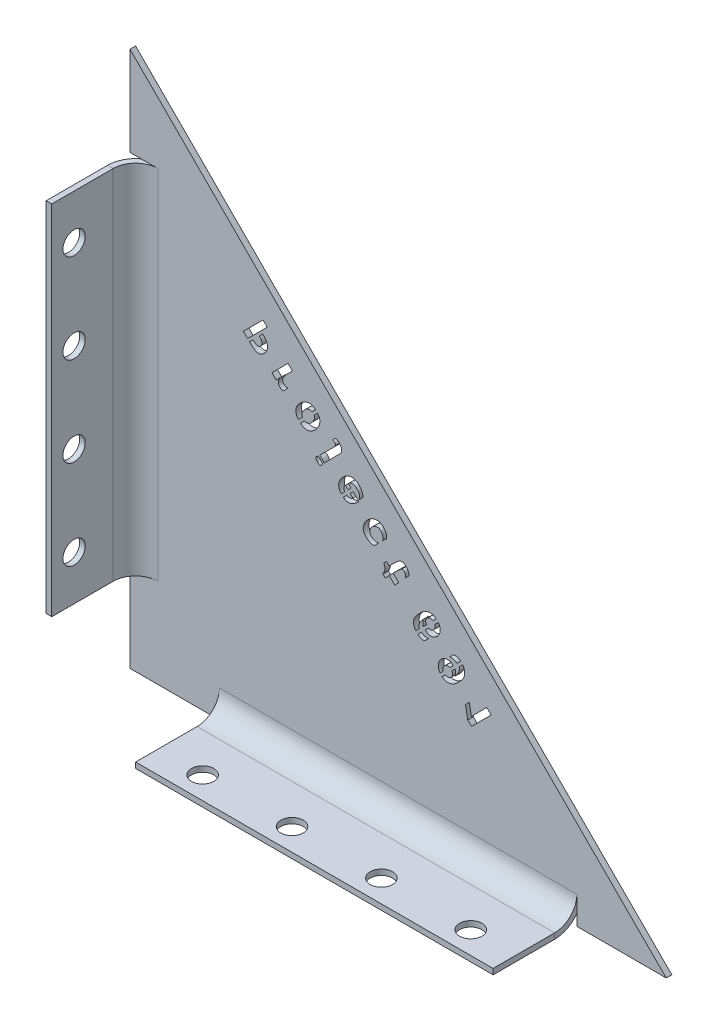
from build123d import *

# Parameters (mm, degrees)
BOSS_EXTRUDE1_DEPTH          = 1.5875
SKETCH7_W                    = 1.5875
SKETCH7_H                    = 101.6
BOSS_EXTRUDE2_DEPTH          = 0.0254
EDGE_FLANGE1_STRIP_W         = 19.05
EDGE_FLANGE1_STRIP_H         = 1.5875
EDGE_FLANGE1_STRIP_CUT_DEPTH = 101.6
EDGE_FLANGE1_DEPTH           = 101.6
SKETCH11_W                   = 101.6
SKETCH11_H                   = 1.5875
BOSS_EXTRUDE3_DEPTH          = 0.0254
EDGE_FLANGE2_STRIP_W         = 19.05
EDGE_FLANGE2_STRIP_H         = 1.5875
EDGE_FLANGE2_STRIP_CUT_DEPTH = 101.6
EDGE_FLANGE2_DEPTH           = 101.6
SKETCH15_R                   = 3.175
CUT_EXTRUDE1_DEPTH           = 2.54
SKETCH16_R                   = 3.175
CUT_EXTRUDE2_DEPTH           = 2.54
CUT_EXTRUDE4_DEPTH           = 2.54


# Sheet-metal steps are written as plain solids
with BuildPart() as part:
    # Sketch1 → Boss-Extrude1 (new body)
    with BuildSketch(Plane.XY):
        Polygon((0, 119.481843199), (0, -32.918156801), (152.4, -32.918156801), align=None)
    extrude(amount=BOSS_EXTRUDE1_DEPTH)

    # Sketch7 → Boss-Extrude2 (add)
    with BuildSketch(Plane.ZY):
        with Locations((0.79375, 43.281843199)):
            Rectangle(SKETCH7_W, SKETCH7_H)
    extrude(amount=BOSS_EXTRUDE2_DEPTH)

    # Edge-Flange1 strip (across the edge) → Edge-Flange1 strip cut (cut)
    with BuildSketch(Plane(origin=(-0.0254, 94.081843199, 1.5875), x_dir=(1, 0, 0), z_dir=(0, -1, 0))):
        with Locations((-1.5875, -0.79375)):
            Rectangle(EDGE_FLANGE1_STRIP_W, EDGE_FLANGE1_STRIP_H)
    extrude(amount=EDGE_FLANGE1_STRIP_CUT_DEPTH, mode=Mode.SUBTRACT)

    # Edge-Flange1 section (across the edge) → Edge-Flange1 (add)
    with BuildSketch(Plane(origin=(-0.0254, 94.081843199, 1.5875), x_dir=(1, 0, 0), z_dir=(0, -1, 0))):
        with BuildLine():
            Line((0, 6.35), (0, 23.8125))
            Line((0, 23.8125), (1.5875, 23.8125))
            Line((1.5875, 23.8125), (1.5875, 6.35))
            ThreePointArc((1.5875, 6.35), (3.447371939, 1.859871939), (7.9375, 0))
            Line((7.9375, 0), (7.9375, -1.5875))
            ThreePointArc((7.9375, -1.5875), (2.324839924, 0.737339924), (0, 6.35))
        make_face()
    extrude(amount=EDGE_FLANGE1_DEPTH)

    # Sketch11 → Boss-Extrude3 (add)
    with BuildSketch(Plane(origin=(0, -32.918156801, 0), x_dir=(-1, 0, 0), z_dir=(0, -1, 0))):
        with Locations((-76.2, -0.79375)):
            Rectangle(SKETCH11_W, SKETCH11_H)
    extrude(amount=BOSS_EXTRUDE3_DEPTH)

    # Edge-Flange2 strip (across the edge) → Edge-Flange2 strip cut (cut)
    with BuildSketch(Plane(origin=(25.4, -32.943556801, 1.5875), x_dir=(0, 1, 0), z_dir=(1, 0, 0))):
        with Locations((-1.5875, -0.79375)):
            Rectangle(EDGE_FLANGE2_STRIP_W, EDGE_FLANGE2_STRIP_H)
    extrude(amount=EDGE_FLANGE2_STRIP_CUT_DEPTH, mode=Mode.SUBTRACT)

    # Edge-Flange2 section (across the edge) → Edge-Flange2 (add)
    with BuildSketch(Plane(origin=(25.4, -32.943556801, 1.5875), x_dir=(0, 1, 0), z_dir=(1, 0, 0))):
        with BuildLine():
            Line((0, 6.35), (0, 23.8125))
            Line((0, 23.8125), (1.5875, 23.8125))
            Line((1.5875, 23.8125), (1.5875, 6.35))
            ThreePointArc((1.5875, 6.35), (3.447371939, 1.859871939), (7.9375, 0))
            Line((7.9375, 0), (7.9375, -1.5875))
            ThreePointArc((7.9375, -1.5875), (2.324839924, 0.737339924), (0, 6.35))
        make_face()
    extrude(amount=EDGE_FLANGE2_DEPTH)

    # Sketch15 → Cut-Extrude1 (cut)
    with BuildSketch(Plane(origin=(0, -31.356056801, 0), x_dir=(1, 0, 0), z_dir=(0, 1, 0))):
        with Locations(Location((38.1, -19.05, 0), (0, 0, 270))):
            Circle(SKETCH15_R)
        with Locations(Location((63.5, -19.05, 0), (0, 0, 270))):
            Circle(SKETCH15_R)
        with Locations(Location((88.9, -19.05, 0), (0, 0, 270))):
            Circle(SKETCH15_R)
        with Locations(Location((114.3, -19.05, 0), (0, 0, 270))):
            Circle(SKETCH15_R)
    extrude(amount=-CUT_EXTRUDE1_DEPTH, mode=Mode.SUBTRACT)

    # Sketch16 → Cut-Extrude2 (cut)
    with BuildSketch(Plane(origin=(1.5621, 0, 0), x_dir=(0, 0, -1), z_dir=(1, 0, 0))):
        with Locations((-19.05, 81.381843199)):
            Circle(SKETCH16_R)
        with Locations((-19.05, 55.981843199)):
            Circle(SKETCH16_R)
        with Locations((-19.05, 30.581843199)):
            Circle(SKETCH16_R)
        with Locations((-19.05, 5.181843199)):
            Circle(SKETCH16_R)
    extrude(amount=-CUT_EXTRUDE2_DEPTH, mode=Mode.SUBTRACT)

    # Sketch19 → Cut-Extrude4 (cut)
    with BuildSketch(Plane(origin=(0, 0, 0), x_dir=(-1, 0, 0), z_dir=(0, 0, -1))):
        with BuildLine():
            add(Edge.make_bspline(
                [(-54.451629709, 44.308400165), (-54.486216356, 44.347097669), (-54.552844966, 44.421645541), (-54.619431381, 44.554473369), (-54.644885888, 44.696657055), (-54.635652404, 44.845922248), (-54.586551979, 45.002877848), (-54.494039294, 45.164239512), (-54.370016404, 45.338062039), (-54.208899848, 45.506933329), (-54.038541356, 45.667558131), (-53.86728466, 45.796755143), (-53.705735912, 45.89260812), (-53.550339865, 45.947667342), (-53.401150145, 45.968395547), (-53.258558385, 45.944748504), (-53.125321358, 45.881598423), (-53.008521132, 45.783078955), (-52.908409106, 45.665084526), (-52.844147531, 45.525943286), (-52.818369511, 45.375023534), (-52.829681514, 45.214256535), (-52.880338366, 45.048503358), (-52.965261587, 44.877991305), (-53.089546945, 44.707389018), (-53.242168849, 44.54028881), (-53.406291032, 44.385842409), (-53.576008153, 44.2647164), (-53.738514348, 44.175383143), (-53.897071431, 44.122809093), (-54.050611902, 44.109146281), (-54.197235932, 44.13527054), (-54.333892833, 44.204126421), (-54.411237162, 44.272626479), (-54.451629709, 44.308400165)],
                knots=[0, 0, 0, 0, 0.89096093, 1.716370149, 2.519710242, 3.350237323, 4.268177873, 5.323688382, 6.539873258, 7.936784, 9.333694741, 10.567414482, 11.623893583, 12.554062634, 13.388976487, 14.188914126, 15.005781945, 15.896742875, 16.80159031, 17.649470878, 18.50136307, 19.41130979, 20.398285583, 21.466456066, 22.676900497, 24.018679477, 25.359804904, 26.548445057, 27.599284631, 28.541936938, 29.403380809, 30.226130366, 31.073608727, 32, 32, 32, 32], degree=3))
        make_face()
        Polygon((-97.041095461, 1.333701079), (-102.620099628, 6.912705246), (-101.390448586, 8.142356288), (-96.99810067, 3.750008371), (-96.421970461, 6.953980246), (-95.359139211, 5.891148996), (-95.98686317, 2.387933371), align=None)
        with BuildLine():
            Line((-93.953304581, 15.81339196), (-92.890473331, 14.75056071))
            add(Edge.make_bspline(
                [(-92.890473331, 14.75056071), (-92.827020703, 14.81059733), (-92.701447887, 14.929409864), (-92.492119234, 15.078359799), (-92.271478041, 15.202284832), (-92.037393519, 15.299625522), (-91.78672288, 15.368897662), (-91.518953423, 15.409021657), (-91.2324372, 15.423864597), (-91.036488157, 15.409695365), (-90.935070206, 15.402361752)],
                knots=[0, 0, 0, 0, 0.980817489, 1.941038821, 2.878509081, 3.820198868, 4.783140073, 5.793726477, 6.858092202, 8, 8, 8, 8], degree=3))
            Line((-90.935070206, 15.402361752), (-91.939428539, 16.406720085))
            add(Edge.make_bspline(
                [(-91.939428539, 16.406720085), (-91.993165972, 16.418939645), (-92.098857026, 16.442973138), (-92.258077532, 16.465620673), (-92.414584879, 16.474358391), (-92.568844285, 16.46923621), (-92.720262944, 16.450371927), (-92.868851097, 16.4176688), (-93.014099424, 16.370516387), (-93.198067554, 16.293917403), (-93.407190155, 16.189744697), (-93.627185453, 16.062698213), (-93.809767033, 15.943255505), (-93.908336009, 15.854076633), (-93.953304581, 15.81339196)],
                knots=[0, 0, 0, 0, 0.906066358, 1.782055884, 2.641294935, 3.480860537, 4.316978217, 5.147335385, 5.979189849, 6.824821184, 8.422826787, 9.816763711, 11.003976472, 12, 12, 12, 12], degree=3))
        make_face()
        with BuildLine():
            Line((-91.829361872, 13.689449252), (-90.900674372, 12.760761752))
            add(Edge.make_bspline(
                [(-90.900674372, 12.760761752), (-90.865046013, 12.778612267), (-90.786299141, 12.818066014), (-90.643909555, 12.853690463), (-90.471358878, 12.873514374), (-90.272722226, 12.884591741), (-90.054211337, 12.864226473), (-89.832377466, 12.782128668), (-89.616102321, 12.645750751), (-89.412378329, 12.464567674), (-89.229701124, 12.262953791), (-89.081677229, 12.05560123), (-88.978372056, 11.848737195), (-88.922837448, 11.643694736), (-88.90655937, 11.446448819), (-88.916750773, 11.259190232), (-88.961433038, 11.081178039), (-89.015975628, 10.974184384), (-89.043299372, 10.920584668)],
                knots=[0, 0, 0, 0, 0.572085397, 1.26444038, 2.09625672, 3.070483045, 4.124420694, 5.228059518, 6.43908216, 7.783856681, 9.138863522, 10.347129936, 11.439116606, 12.447625815, 13.383377729, 14.276112387, 15.136398451, 16, 16, 16, 16], degree=3))
            Line((-89.043299372, 10.920584668), (-88.123210831, 10.000496127))
            add(Edge.make_bspline(
                [(-88.123210831, 10.000496127), (-88.082613908, 10.04548828), (-88.000236962, 10.136783776), (-87.893894157, 10.292878584), (-87.809570633, 10.470904124), (-87.736046463, 10.66546123), (-87.683128216, 10.88049402), (-87.639940334, 11.113416514), (-87.620970711, 11.366235546), (-87.609935458, 11.632628123), (-87.623929923, 11.904280281), (-87.660394655, 12.17257981), (-87.72704783, 12.430825807), (-87.81613279, 12.681079235), (-87.934569663, 12.920789181), (-88.077536649, 13.152055351), (-88.247666053, 13.373173895), (-88.440077953, 13.581206228), (-88.645217386, 13.773318753), (-88.856778748, 13.942590593), (-89.071120764, 14.085769735), (-89.286140919, 14.206801892), (-89.50662817, 14.297554693), (-89.728506548, 14.366403101), (-89.95451886, 14.405135213), (-90.181072416, 14.421538348), (-90.40647744, 14.410248356), (-90.627217845, 14.37790837), (-90.842528353, 14.322683011), (-91.052166568, 14.242435821), (-91.256545267, 14.139011842), (-91.45560899, 14.012779996), (-91.647390526, 13.861639905), (-91.76774808, 13.747751393), (-91.829361872, 13.689449252)],
                knots=[0, 0, 0, 0, 0.749332702, 1.520502905, 2.326225067, 3.181293294, 4.089626218, 5.062179955, 6.108903827, 7.223051897, 8.359331748, 9.469748303, 10.567291151, 11.653221413, 12.75078718, 13.868789315, 15.012219258, 16.196922747, 17.371218932, 18.486698271, 19.545060865, 20.557780294, 21.533871024, 22.48975453, 23.426150137, 24.364585121, 25.294727598, 26.212564909, 27.120897833, 28.039063961, 28.98433606, 29.950480165, 30.950803785, 32, 32, 32, 32], degree=3))
        make_face()
        with BuildLine():
            add(Edge.make_bspline(
                [(-92.381414997, 13.137396127), (-92.401408019, 13.093668754), (-92.444054479, 13.000395323), (-92.488598898, 12.842843104), (-92.522393509, 12.662722038), (-92.545666044, 12.458206646), (-92.547858581, 12.224483646), (-92.51554026, 11.959650592), (-92.454557546, 11.662090246), (-92.395505671, 11.455065245), (-92.364217081, 11.34537321)],
                knots=[0, 0, 0, 0, 0.62829261, 1.340190433, 2.134471608, 3.024813884, 4.029827998, 5.184373668, 6.508142579, 8, 8, 8, 8], degree=3))
            add(Edge.make_bspline(
                [(-92.364217081, 11.34537321), (-92.431804593, 11.42117066), (-92.563634646, 11.569014269), (-92.748121922, 11.793046799), (-92.915441014, 12.013116992), (-93.064818903, 12.229703559), (-93.198429474, 12.441453372), (-93.313406893, 12.650347094), (-93.414677041, 12.854223543), (-93.493931047, 13.054527701), (-93.558434918, 13.244258279), (-93.603360511, 13.42132269), (-93.631244629, 13.583577491), (-93.635970005, 13.730845421), (-93.626231495, 13.864138642), (-93.59259236, 13.981852104), (-93.54348607, 14.087966721), (-93.493338721, 14.144506523), (-93.468323331, 14.17271071)],
                knots=[0, 0, 0, 0, 1.505393456, 2.936283515, 4.301144198, 5.602399503, 6.835634825, 8.011059706, 9.136095676, 10.2076363, 11.201985935, 12.104778921, 12.913735962, 13.636550114, 14.285162681, 14.885188552, 15.443889973, 16, 16, 16, 16], degree=3))
            Line((-93.468323331, 14.17271071), (-94.531154581, 15.23554196))
            add(Edge.make_bspline(
                [(-94.531154581, 15.23554196), (-94.546476559, 15.21925938), (-94.580136534, 15.183489113), (-94.624866186, 15.11754167), (-94.672730646, 15.039624409), (-94.725803286, 14.950321381), (-94.775106416, 14.844714445), (-94.83180932, 14.72845939), (-94.885241563, 14.596498155), (-94.964591032, 14.406586498), (-95.045562833, 14.15489064), (-95.10878384, 13.843435317), (-95.131915164, 13.525834903), (-95.120967072, 13.203011404), (-95.066775254, 12.87590739), (-94.968828804, 12.545691483), (-94.825629337, 12.214192568), (-94.674673474, 11.935822206), (-94.524157913, 11.70728388), (-94.388298876, 11.518439466), (-94.229532141, 11.315716781), (-94.048702919, 11.099068762), (-93.845366575, 10.869371199), (-93.621299048, 10.623896683), (-93.373454466, 10.365993214), (-93.111686754, 10.095666169), (-92.835532734, 9.834252467), (-92.549409162, 9.597323297), (-92.258512522, 9.390408532), (-91.964110859, 9.21282349), (-91.666761888, 9.063154132), (-91.36462485, 8.943783402), (-91.058274232, 8.854461593), (-90.750957517, 8.793542436), (-90.448500585, 8.765001506), (-90.156853799, 8.763232258), (-89.878878069, 8.794850197), (-89.614090896, 8.854300056), (-89.362594349, 8.946160682), (-89.126084254, 9.069236092), (-88.902988468, 9.221746894), (-88.769059657, 9.34358707), (-88.701060831, 9.40544821)],
                knots=[0, 0, 0, 0, 0.246047121, 0.54052682, 0.875339091, 1.254582366, 1.684013454, 2.158772054, 2.679702756, 3.252169111, 4.426864954, 5.586482217, 6.745910187, 7.928056321, 9.137963352, 10.389281836, 11.713984913, 13.110531903, 13.87271873, 14.728252196, 15.673472726, 16.709591897, 17.837528405, 19.053719, 20.371838385, 21.778989529, 23.200179869, 24.559848916, 25.869219826, 27.130291179, 28.345102835, 29.533444252, 30.704908277, 31.857102753, 32.980394827, 34.048003767, 35.06513386, 36.056634424, 37.031902402, 38.006679225, 38.987943888, 40, 40, 40, 40], degree=3))
            Line((-88.701060831, 9.40544821), (-89.629748331, 10.33413571))
            add(Edge.make_bspline(
                [(-89.629748331, 10.33413571), (-89.667487721, 10.303972747), (-89.750294481, 10.237789978), (-89.916911043, 10.177856954), (-90.121639488, 10.141549584), (-90.315636636, 10.125537564), (-90.483888708, 10.128606499), (-90.611927818, 10.146088424), (-90.736579024, 10.177041387), (-90.857187765, 10.222539547), (-90.975133653, 10.27927401), (-91.089030024, 10.35050112), (-91.199480749, 10.435279992), (-91.304338185, 10.532368431), (-91.401669469, 10.636673511), (-91.483896193, 10.748005897), (-91.555569602, 10.859843007), (-91.613311908, 10.975374478), (-91.653794574, 11.095501683), (-91.684556654, 11.217806572), (-91.697059713, 11.343923344), (-91.699148886, 11.509206567), (-91.678715482, 11.702608574), (-91.632770637, 11.909392159), (-91.564301943, 12.083441729), (-91.494334179, 12.174398274), (-91.461326456, 12.217307585)],
                knots=[0, 0, 0, 0, 0.941398391, 2.065591195, 3.415888152, 5.015585384, 5.869499527, 6.708209235, 7.541789172, 8.38049888, 9.229449441, 10.102141201, 11.007470802, 11.953414455, 12.899358108, 13.797904023, 14.661075357, 15.499935466, 16.320473825, 17.1404739, 17.965305893, 18.796536752, 20.376834823, 21.76085807, 22.943670992, 24, 24, 24, 24], degree=3))
            Line((-91.461326456, 12.217307585), (-92.381414997, 13.137396127))
        make_face()
        with BuildLine():
            add(Edge.make_bspline(
                [(-82.835806409, 17.444519299), (-82.899276743, 17.384517912), (-83.024884601, 17.265775107), (-83.234365557, 17.116022379), (-83.456635712, 16.993714048), (-83.690121662, 16.893140388), (-83.941359555, 16.824782847), (-84.209539563, 16.783621475), (-84.496772528, 16.771872643), (-84.693243474, 16.785621819), (-84.794649117, 16.792718257)],
                knots=[0, 0, 0, 0, 0.979072112, 1.937584718, 2.879005898, 3.821503001, 4.78273064, 5.791518692, 6.860124242, 8, 8, 8, 8], degree=3))
            Line((-84.794649117, 16.792718257), (-83.790290784, 15.788359924))
            add(Edge.make_bspline(
                [(-83.790290784, 15.788359924), (-83.736553267, 15.776140095), (-83.630862048, 15.752106074), (-83.471642739, 15.729462378), (-83.315130996, 15.72071055), (-83.160887569, 15.725884025), (-83.00940992, 15.744558952), (-82.861208896, 15.777926107), (-82.71529998, 15.822374328), (-82.53093164, 15.899848018), (-82.322187091, 16.005602228), (-82.099535947, 16.130639576), (-81.917237408, 16.251493961), (-81.817985241, 16.341067258), (-81.772975159, 16.381688049)],
                knots=[0, 0, 0, 0, 0.904693802, 1.779356334, 2.637293765, 3.475587551, 4.310438636, 5.139537936, 5.967300108, 6.811650437, 8.419848378, 9.806986057, 11.0054853, 12, 12, 12, 12], degree=3))
            Line((-81.772975159, 16.381688049), (-82.835806409, 17.444519299))
        make_face()
        with BuildLine():
            add(Edge.make_bspline(
                [(-84.827325159, 19.436038049), (-84.854564989, 19.416011652), (-84.917873529, 19.369467973), (-85.051622074, 19.336000663), (-85.222401135, 19.313369317), (-85.390322439, 19.305807729), (-85.538844038, 19.313379107), (-85.654314521, 19.33259974), (-85.768038128, 19.365369098), (-85.880772719, 19.412722561), (-85.991897258, 19.472673176), (-86.101555887, 19.546191287), (-86.209251038, 19.632330901), (-86.314707258, 19.728622122), (-86.412016616, 19.834446058), (-86.497697852, 19.945576316), (-86.570635578, 20.060199473), (-86.63154299, 20.177218872), (-86.678216999, 20.298346281), (-86.711251917, 20.422905492), (-86.729741686, 20.551014973), (-86.73636408, 20.67882448), (-86.732295804, 20.800401531), (-86.732199117, 20.910531316), (-86.726915331, 21.006336768), (-86.719387485, 21.087024179), (-86.714040591, 21.153453017), (-86.703536642, 21.204403556), (-86.6931487, 21.242501832), (-86.681042255, 21.260337021), (-86.6761012, 21.267616174)],
                knots=[0, 0, 0, 0, 0.85560708, 1.988530585, 3.450300191, 5.264639633, 6.260510601, 7.238733058, 8.242833179, 9.271849073, 10.351149459, 11.458117423, 12.633996484, 13.865282824, 15.096569164, 16.295489222, 17.439209424, 18.557320352, 19.654201837, 20.742868331, 21.836627571, 22.949277022, 24.002010568, 24.937797688, 25.757685454, 26.447304249, 27.005929431, 27.453212033, 27.776837077, 28, 28, 28, 28], degree=3))
            Line((-86.6761012, 21.267616174), (-87.596189742, 22.187704716))
            add(Edge.make_bspline(
                [(-87.596189742, 22.187704716), (-87.637728652, 22.14296701), (-87.721860968, 22.0523559), (-87.823727289, 21.893035781), (-87.912848886, 21.717662182), (-87.984190299, 21.522284359), (-88.040709462, 21.308092454), (-88.081368704, 21.075064093), (-88.106985863, 20.823367105), (-88.115231911, 20.55732204), (-88.105093864, 20.286098857), (-88.066690875, 20.019394393), (-88.00360697, 19.761297398), (-87.910808177, 19.51319339), (-87.795838463, 19.271960291), (-87.651786714, 19.041979957), (-87.484019898, 18.819577756), (-87.291221465, 18.612266303), (-87.08629021, 18.41995225), (-86.874529132, 18.251001171), (-86.660556892, 18.106679856), (-86.443395396, 17.989088161), (-86.223192969, 17.897339708), (-86.0011858, 17.828722992), (-85.775209653, 17.789940142), (-85.54863697, 17.773514425), (-85.323272028, 17.784943402), (-85.101699225, 17.816859237), (-84.886247078, 17.874327814), (-84.67579939, 17.954236263), (-84.471463579, 18.057823395), (-84.272387939, 18.184009906), (-84.080609703, 18.335162549), (-83.960251688, 18.449049306), (-83.898637659, 18.507350549)],
                knots=[0, 0, 0, 0, 0.754218705, 1.527583814, 2.330364635, 3.185698592, 4.096112628, 5.068968605, 6.110304904, 7.224799218, 8.361099975, 9.464837378, 10.55411321, 11.642811209, 12.737618736, 13.855968312, 14.995454345, 16.180526003, 17.355187124, 18.471013122, 19.529704623, 20.545567307, 21.521961377, 22.478141943, 23.414828553, 24.353555175, 25.283986712, 26.20210926, 27.119381554, 28.03783302, 28.983398881, 29.949843235, 30.950477726, 32, 32, 32, 32], degree=3))
            Line((-83.898637659, 18.507350549), (-84.827325159, 19.436038049))
        make_face()
        with BuildLine():
            Line((-87.002861617, 22.798230757), (-86.082773075, 21.878142216))
            add(Edge.make_bspline(
                [(-86.082773075, 21.878142216), (-86.044871819, 21.905930097), (-85.960944985, 21.967462329), (-85.795847099, 22.020790953), (-85.593785164, 22.057947286), (-85.401441526, 22.069670037), (-85.233761598, 22.070616466), (-85.106494158, 22.052079461), (-84.98244418, 22.022979749), (-84.861844006, 21.979782755), (-84.744377551, 21.922487015), (-84.630501994, 21.852040666), (-84.521577106, 21.766029622), (-84.416608609, 21.669757196), (-84.320167289, 21.565314289), (-84.236117771, 21.455302533), (-84.166067973, 21.342327166), (-84.107940027, 21.226601503), (-84.066573427, 21.106725659), (-84.039779282, 20.984300568), (-84.022589608, 20.858810508), (-84.025326256, 20.69323029), (-84.044069242, 20.500179566), (-84.088299276, 20.293540468), (-84.156881026, 20.120257674), (-84.226806252, 20.029287244), (-84.259793909, 19.986371382)],
                knots=[0, 0, 0, 0, 0.920246832, 2.037753089, 3.370223432, 4.965495549, 5.823278378, 6.666006617, 7.489935579, 8.328801025, 9.181819185, 10.058692295, 10.959424894, 11.90990087, 12.860376847, 13.754225126, 14.631098236, 15.473977597, 16.298447423, 17.1198218, 17.938711394, 18.78513434, 20.373004133, 21.750129612, 22.938609776, 24, 24, 24, 24], degree=3))
            Line((-84.259793909, 19.986371382), (-83.339705367, 19.066282841))
            add(Edge.make_bspline(
                [(-83.339705367, 19.066282841), (-83.337314023, 19.070825874), (-83.329849873, 19.085006136), (-83.320709741, 19.115741412), (-83.310995106, 19.16244899), (-83.299460155, 19.224596971), (-83.282656563, 19.302099147), (-83.269007958, 19.396648977), (-83.248774741, 19.506306227), (-83.223146292, 19.67714832), (-83.200083667, 19.911374552), (-83.214468037, 20.211186826), (-83.265055902, 20.529873402), (-83.324327096, 20.744731513), (-83.355183492, 20.856585966)],
                knots=[0, 0, 0, 0, 0.101550044, 0.316970218, 0.630996386, 1.047382525, 1.568414415, 2.201169797, 2.938457384, 3.776629817, 5.622774983, 7.588561941, 9.703419321, 12, 12, 12, 12], degree=3))
            add(Edge.make_bspline(
                [(-83.355183492, 20.856585966), (-83.287303255, 20.781607125), (-83.154573218, 20.634996792), (-82.973627848, 20.408484908), (-82.806184355, 20.189093034), (-82.655239839, 19.973520094), (-82.523259363, 19.76072166), (-82.407628428, 19.551664722), (-82.306470336, 19.347722247), (-82.227162937, 19.147435536), (-82.162757197, 18.957697243), (-82.117532783, 18.780646007), (-82.090589978, 18.618328731), (-82.082877984, 18.471160091), (-82.093298383, 18.337815205), (-82.126777427, 18.22010834), (-82.175921929, 18.113992148), (-82.226064323, 18.057452551), (-82.251077242, 18.029248466)],
                knots=[0, 0, 0, 0, 1.499452607, 2.931963819, 4.297215525, 5.591857327, 6.832659565, 8.008421198, 9.133779482, 10.205627096, 11.200261605, 12.103313234, 12.912502037, 13.635873002, 14.284671392, 14.884869166, 15.443730651, 16, 16, 16, 16], degree=3))
            Line((-82.251077242, 18.029248466), (-81.19684495, 16.957818257))
            add(Edge.make_bspline(
                [(-81.19684495, 16.957818257), (-81.164179404, 16.996563853), (-81.088849575, 17.08591485), (-80.991285161, 17.260333751), (-80.882860731, 17.48277451), (-80.773383265, 17.749701653), (-80.672485601, 18.045286858), (-80.611242392, 18.358091752), (-80.586771431, 18.676129746), (-80.600765441, 18.998929363), (-80.65448586, 19.326522356), (-80.751584996, 19.657118322), (-80.896008538, 19.988117314), (-81.046402267, 20.266159075), (-81.196986602, 20.494658721), (-81.332746952, 20.683579992), (-81.491674328, 20.885698052), (-81.670617264, 21.103423202), (-81.874019484, 21.333142335), (-82.099990598, 21.576828175), (-82.345764815, 21.837238665), (-82.609503672, 22.105690072), (-82.88609003, 22.367630819), (-83.171070382, 22.606614143), (-83.462561002, 22.812380504), (-83.755350527, 22.992364129), (-84.05416074, 23.137380642), (-84.354335763, 23.258746111), (-84.660045603, 23.346085515), (-84.966337587, 23.404124193), (-85.26746366, 23.434548396), (-85.557815343, 23.432156697), (-85.834419011, 23.404782844), (-86.097276399, 23.343805937), (-86.346098962, 23.252122688), (-86.581290615, 23.131118465), (-86.802632384, 22.980202934), (-86.935431491, 22.859512552), (-87.002861617, 22.798230757)],
                knots=[0, 0, 0, 0, 0.502037088, 1.157744874, 1.97454839, 2.959285973, 4.01902647, 5.069008332, 6.113240045, 7.17816074, 8.267856111, 9.400307047, 10.588158337, 11.845949846, 12.532408751, 13.302939737, 14.15424683, 15.083789136, 16.099658256, 17.198862789, 18.382099562, 19.653432753, 20.933419144, 22.161626123, 23.340903029, 24.471809323, 25.568493029, 26.633474518, 27.681496838, 28.718136979, 29.724159769, 30.680022608, 31.595476004, 32.477375997, 33.350403549, 34.220664323, 35.096523834, 36, 36, 36, 36], degree=3))
        make_face()
        with BuildLine():
            Line((-73.676579668, 26.78948354), (-75.248469251, 25.217593956))
            Line((-75.248469251, 25.217593956), (-76.368053626, 26.337178331))
            Line((-76.368053626, 26.337178331), (-74.778966126, 27.926265831))
            add(Edge.make_bspline(
                [(-74.778966126, 27.926265831), (-74.864319861, 28.011744827), (-75.030158668, 28.177827012), (-75.272647007, 28.418604234), (-75.501402091, 28.643877587), (-75.715853685, 28.85366241), (-75.917456305, 29.047077221), (-76.106610855, 29.223023373), (-76.28020712, 29.386048067), (-76.441946532, 29.531534914), (-76.589042036, 29.662623033), (-76.723741565, 29.776103607), (-76.844092482, 29.874945753), (-76.951361241, 29.956991361), (-77.045614583, 30.023286358), (-77.125035179, 30.07540189), (-77.192322812, 30.111019777), (-77.263485507, 30.136710415), (-77.344390906, 30.14830907), (-77.437539133, 30.15068767), (-77.529790866, 30.138417449), (-77.620568148, 30.111883346), (-77.71061434, 30.071702526), (-77.799648895, 30.018005765), (-77.888651692, 29.951548654), (-77.976018828, 29.871668108), (-78.05808797, 29.774150407), (-78.129955402, 29.657378377), (-78.194077286, 29.522114944), (-78.246190167, 29.367178227), (-78.288858371, 29.193329621), (-78.323199418, 29.000368673), (-78.346420492, 28.787739741), (-78.35508239, 28.639454153), (-78.359572376, 28.562588748)],
                knots=[0, 0, 0, 0, 2.101008207, 4.082172786, 5.943522058, 7.68509019, 9.300008141, 10.802546222, 12.178252559, 13.441861742, 14.586194535, 15.604965906, 16.505040786, 17.294744402, 17.953113938, 18.509065358, 18.94607414, 19.274048666, 19.819894317, 20.358405463, 20.891442757, 21.431060434, 21.997990298, 22.601610091, 23.235750963, 23.927261849, 24.656216208, 25.444659925, 26.305439678, 27.254545304, 28.282303508, 29.416689186, 30.660913489, 32, 32, 32, 32], degree=3))
            Line((-78.359572376, 28.562588748), (-79.279660918, 29.48267729))
            add(Edge.make_bspline(
                [(-79.279660918, 29.48267729), (-79.277684024, 29.575693828), (-79.273784669, 29.759165731), (-79.232633413, 30.029533805), (-79.165981726, 30.290287669), (-79.070331564, 30.541580716), (-78.947286758, 30.783506831), (-78.796753855, 31.017241448), (-78.616905654, 31.240247072), (-78.415692061, 31.449896022), (-78.202433377, 31.636793464), (-77.983747097, 31.787833665), (-77.766174911, 31.900335171), (-77.549912852, 31.975985062), (-77.332561346, 32.004703505), (-77.117012354, 31.996636987), (-76.90316316, 31.947320402), (-76.727955916, 31.872267016), (-76.584859352, 31.790456477), (-76.464467616, 31.714551041), (-76.333215708, 31.624337075), (-76.190667652, 31.519764581), (-76.038213846, 31.398359479), (-75.873190064, 31.265466151), (-75.69901299, 31.115471421), (-75.511643401, 30.953902194), (-75.316198406, 30.773615083), (-75.108070149, 30.58104754), (-74.887475822, 30.375759857), (-74.658973336, 30.151859034), (-74.416774593, 29.916545418), (-74.166008807, 29.663964911), (-73.902095978, 29.399881274), (-73.724502416, 29.216910956), (-73.633584876, 29.123240831)],
                knots=[0, 0, 0, 0, 1.085389273, 2.140892794, 3.184807694, 4.222868981, 5.273607416, 6.348647858, 7.463021242, 8.61342064, 9.738059799, 10.768496461, 11.708500936, 12.591179862, 13.428961146, 14.252964721, 15.097351619, 15.976291711, 16.467810808, 17.02124563, 17.637646695, 18.327129035, 19.085054335, 19.913017793, 20.800960146, 21.768794264, 22.801706426, 23.905353264, 25.079785544, 26.320015897, 27.64064166, 29.02272206, 30.475807449, 32, 32, 32, 32], degree=3))
            Line((-73.633584876, 29.123240831), (-72.880316126, 29.859311665))
            Line((-72.880316126, 29.859311665), (-72.085772376, 29.064767915))
            add(Edge.make_bspline(
                [(-72.085772376, 29.064767915), (-72.121749229, 29.002823226), (-72.192004912, 28.881857493), (-72.278150882, 28.695332957), (-72.345373849, 28.510505915), (-72.396384284, 28.327855224), (-72.427013076, 28.146260973), (-72.44151049, 27.966667482), (-72.436686788, 27.7883895), (-72.40196749, 27.552955027), (-72.331148337, 27.258503346), (-72.209145653, 26.907688681), (-72.055083542, 26.554596325), (-71.926222577, 26.32749645), (-71.860479668, 26.21163354)],
                knots=[0, 0, 0, 0, 0.849700362, 1.659296869, 2.434018451, 3.181594192, 3.906287857, 4.615849473, 5.316815592, 6.017187309, 7.436196407, 8.903354277, 10.420138338, 12, 12, 12, 12], degree=3))
            Line((-71.860479668, 26.21163354), (-72.496802585, 25.558112706))
            Line((-72.496802585, 25.558112706), (-73.676579668, 26.78948354))
        make_face()
        with BuildLine():
            add(Edge.make_bspline(
                [(-70.665807659, 33.263915965), (-70.562760443, 33.252037362), (-70.362822022, 33.228989779), (-70.069553807, 33.230508319), (-69.793365107, 33.254764939), (-69.530581552, 33.309076544), (-69.278293944, 33.40285238), (-69.031336708, 33.535185854), (-68.790526611, 33.711997156), (-68.596899653, 33.88638437), (-68.451800541, 34.04324844), (-68.355775827, 34.169067301), (-68.278988257, 34.302123908), (-68.216129236, 34.438968129), (-68.168978121, 34.580668906), (-68.140159518, 34.728065952), (-68.12649751, 34.880205669), (-68.128037312, 35.036421709), (-68.14699774, 35.195704102), (-68.184925741, 35.355560881), (-68.242529771, 35.515108981), (-68.319202836, 35.673397039), (-68.412397493, 35.832512794), (-68.525076568, 35.990876212), (-68.656290947, 36.149365174), (-68.803866117, 36.303887983), (-68.95839307, 36.452243638), (-69.119760141, 36.58235344), (-69.279138062, 36.699763794), (-69.442610886, 36.795678686), (-69.606800682, 36.873518925), (-69.771729796, 36.93494634), (-69.938379149, 36.977732522), (-70.105411177, 37.00352656), (-70.269749386, 37.013136141), (-70.429380249, 37.001781897), (-70.582975156, 36.976775007), (-70.731211595, 36.933649935), (-70.872213322, 36.87031901), (-71.009846996, 36.793000553), (-71.139972684, 36.696039775), (-71.3019681, 36.547956472), (-71.480681109, 36.350175532), (-71.65409143, 36.100194497), (-71.788150701, 35.849492967), (-71.869523943, 35.588449349), (-71.910561838, 35.316606014), (-71.916645136, 35.028319334), (-71.885929835, 34.719405039), (-71.842439388, 34.509845196), (-71.819787867, 34.400698257)],
                knots=[0, 0, 0, 0, 1.470542692, 2.853235619, 4.152202258, 5.39967885, 6.647712132, 7.957683506, 9.361764752, 10.87618873, 11.647627645, 12.39103021, 13.116416951, 13.822532992, 14.524703169, 15.229740991, 15.948439463, 16.688631542, 17.442242091, 18.219532929, 19.01449555, 19.84395181, 20.711608562, 21.62780905, 22.598390114, 23.628264403, 24.658138692, 25.635004099, 26.56727354, 27.464209558, 28.319193501, 29.14264638, 29.95737668, 30.755702436, 31.537575595, 32.287446119, 33.021535637, 33.742164492, 34.470554541, 35.210031285, 35.977860104, 36.766808421, 38.321730491, 39.747668001, 41.075445872, 42.338443232, 43.60611978, 44.964801815, 46.419150403, 48, 48, 48, 48], degree=3))
            Line((-71.819787867, 34.400698257), (-72.9066962, 35.48760659))
            add(Edge.make_bspline(
                [(-72.9066962, 35.48760659), (-72.918403373, 35.597526674), (-72.941113068, 35.810750792), (-72.932486466, 36.12459628), (-72.886513319, 36.420252806), (-72.815030334, 36.655213408), (-72.734923711, 36.839710279), (-72.653846777, 36.984834676), (-72.556121447, 37.138603736), (-72.440162007, 37.301536665), (-72.303485881, 37.470503893), (-72.150988031, 37.649435879), (-71.978786024, 37.835771097), (-71.793814658, 38.02884106), (-71.591874686, 38.212972326), (-71.369838873, 38.36712655), (-71.134167828, 38.490357197), (-70.885164798, 38.582313013), (-70.622518912, 38.640652254), (-70.347169591, 38.667792965), (-70.058285893, 38.663666414), (-69.759713142, 38.628188795), (-69.458069193, 38.567296516), (-69.161438791, 38.47890012), (-68.872825304, 38.366467245), (-68.591705191, 38.229991472), (-68.317928967, 38.069730001), (-68.05182567, 37.885139149), (-67.79558304, 37.673777885), (-67.548653467, 37.442177007), (-67.316980236, 37.19483224), (-67.104464415, 36.938885985), (-66.916609633, 36.674626436), (-66.750655611, 36.404515618), (-66.608519018, 36.126448064), (-66.492212131, 35.840575799), (-66.396856662, 35.548175619), (-66.324311008, 35.252405278), (-66.281384453, 34.958191472), (-66.267151685, 34.673262212), (-66.290205534, 34.401252182), (-66.343401906, 34.141606684), (-66.429628487, 33.894356847), (-66.549625019, 33.660209375), (-66.702652856, 33.439562508), (-66.886236201, 33.238789404), (-67.078124014, 33.053259011), (-67.262147287, 32.879956112), (-67.436977676, 32.726256918), (-67.600292683, 32.588673652), (-67.755471447, 32.472111936), (-67.89997259, 32.371214156), (-68.034830812, 32.288871828), (-68.204181552, 32.200440307), (-68.431097553, 32.122625724), (-68.729214646, 32.057166199), (-69.066238737, 32.024243891), (-69.303104199, 32.025176143), (-69.427557659, 32.025665965)],
                knots=[0, 0, 0, 0, 1.212110388, 2.351264303, 3.43418508, 4.486934378, 5.036295743, 5.638814002, 6.309033391, 7.0352594, 7.832092646, 8.693261309, 9.614991124, 10.61601471, 11.627501145, 12.608313668, 13.573505734, 14.538861815, 15.512627365, 16.517990897, 17.568708004, 18.676846608, 19.813200097, 20.941864807, 22.069283915, 23.208854694, 24.367712417, 25.547471964, 26.759010776, 28.009707902, 29.260405029, 30.475939234, 31.657793749, 32.815540923, 33.952242666, 35.080819703, 36.198932209, 37.325051617, 38.418520337, 39.457513304, 40.448622668, 41.406094968, 42.359154594, 43.312982207, 44.28503911, 45.296525545, 46.293051283, 47.214437506, 48.070234978, 48.847556726, 49.557216224, 50.199418809, 50.780978401, 51.290260338, 52.293239224, 53.401431403, 54.634664375, 56, 56, 56, 56], degree=3))
            Line((-69.427557659, 32.025665965), (-70.665807659, 33.263915965))
        make_face()
        with BuildLine():
            Line((-63.401519343, 42.299589698), (-62.548502676, 41.446573032))
            Line((-62.548502676, 41.446573032), (-63.351645384, 40.643430323))
            add(Edge.make_bspline(
                [(-63.351645384, 40.643430323), (-63.304360757, 40.61370488), (-63.212333688, 40.555852138), (-63.072800746, 40.479358302), (-62.934567394, 40.417256523), (-62.799351919, 40.367874781), (-62.667603834, 40.328360544), (-62.537825131, 40.30491795), (-62.410618932, 40.291612896), (-62.251053308, 40.295901256), (-62.069812359, 40.313887183), (-61.88108504, 40.357673299), (-61.724858037, 40.416113146), (-61.647249335, 40.479743496), (-61.611216218, 40.509286573)],
                knots=[0, 0, 0, 0, 1.080366058, 2.102647872, 3.075552691, 4.008840917, 4.886296197, 5.732425285, 6.556760715, 7.355329272, 8.816413178, 10.069944751, 11.103890339, 12, 12, 12, 12], degree=3))
            Line((-61.611216218, 40.509286573), (-60.617176634, 39.498049073))
            add(Edge.make_bspline(
                [(-60.617176634, 39.498049073), (-60.668273435, 39.450895769), (-60.770606065, 39.356460861), (-60.944637246, 39.237298725), (-61.134430461, 39.139470392), (-61.339965817, 39.06165164), (-61.561170837, 39.003097771), (-61.79861591, 38.965869829), (-62.051775554, 38.949966253), (-62.271904655, 38.950037668), (-62.456535531, 38.964390765), (-62.600650285, 38.991345384), (-62.749229148, 39.028779074), (-62.900535465, 39.081252228), (-63.055853567, 39.145559817), (-63.216040777, 39.220761266), (-63.378915362, 39.311073185), (-63.54647923, 39.412307853), (-63.716319603, 39.528749192), (-63.89148992, 39.654980977), (-64.069450109, 39.795547276), (-64.251037146, 39.948983702), (-64.439050151, 40.112921145), (-64.627475867, 40.293376362), (-64.822198556, 40.483368639), (-64.950823378, 40.616716768), (-65.016403718, 40.684705323)],
                knots=[0, 0, 0, 0, 0.978268325, 1.959198429, 2.959475274, 3.979115361, 5.048404036, 6.176663684, 7.358206194, 8.61775121, 9.274169846, 9.963100784, 10.679810482, 11.430460591, 12.216116228, 13.046780638, 13.921181679, 14.837838197, 15.802991469, 16.820423536, 17.878373968, 18.99586468, 20.168574398, 21.390794942, 22.669677026, 24, 24, 24, 24], degree=3))
            Line((-65.016403718, 40.684705323), (-63.401519343, 42.299589698))
        make_face()
        with BuildLine():
            add(Edge.make_bspline(
                [(-66.161784968, 42.215319907), (-66.163877608, 42.337502818), (-66.167956764, 42.575672401), (-66.129426329, 42.923170677), (-66.055364462, 43.249225865), (-65.963580178, 43.508037312), (-65.863454342, 43.707555353), (-65.77451573, 43.864505927), (-65.665885886, 44.025942197), (-65.544833609, 44.1964344), (-65.404879256, 44.371693249), (-65.247140802, 44.552532024), (-65.073989582, 44.740664889), (-64.888533858, 44.933820171), (-64.687981215, 45.117811057), (-64.468224618, 45.27469356), (-64.235313174, 45.405157535), (-63.989275167, 45.509062138), (-63.728495655, 45.582267425), (-63.456136082, 45.631585316), (-63.16957922, 45.648482458), (-62.872451887, 45.642819932), (-62.569147295, 45.605044319), (-62.265617859, 45.534340994), (-61.965970504, 45.427186481), (-61.66615559, 45.292149764), (-61.372627768, 45.117116682), (-61.078504642, 44.913846295), (-60.788322862, 44.67547397), (-60.506210944, 44.408964544), (-60.240114469, 44.127514321), (-60.003298203, 43.838215548), (-59.800841888, 43.546984896), (-59.632145402, 43.253434116), (-59.499398774, 42.957169269), (-59.399650436, 42.658970285), (-59.3355264, 42.358951849), (-59.307258159, 42.059477916), (-59.307446926, 41.767031613), (-59.332464794, 41.485327265), (-59.384477038, 41.217571178), (-59.459832523, 40.963019964), (-59.561347, 40.722634106), (-59.690649161, 40.497281681), (-59.843255767, 40.284318297), (-59.963316294, 40.156048414), (-60.023848509, 40.091377198)],
                knots=[0, 0, 0, 0, 1.250245971, 2.437088431, 3.569076056, 4.668313061, 5.237939865, 5.853132467, 6.514085654, 7.229170028, 7.99368854, 8.809250996, 9.68579403, 10.611430026, 11.550754987, 12.467809102, 13.369156445, 14.279404135, 15.195311684, 16.137164031, 17.107803571, 18.129389843, 19.176309578, 20.231310085, 21.313569498, 22.429880817, 23.592616785, 24.807276671, 26.087947032, 27.433335938, 28.778724844, 30.05113656, 31.257628516, 32.40647363, 33.512600023, 34.576170705, 35.620322463, 36.64650182, 37.650209355, 38.6110024, 39.537679983, 40.438339042, 41.324673318, 42.202689056, 43.093830289, 44, 44, 44, 44], degree=3))
            Line((-60.023848509, 40.091377198), (-61.026487051, 41.09401574))
            add(Edge.make_bspline(
                [(-61.026487051, 41.09401574), (-60.996895371, 41.130038217), (-60.931666921, 41.209441967), (-60.874057616, 41.369965608), (-60.826727573, 41.564945531), (-60.808032836, 41.752183095), (-60.803444134, 41.916374587), (-60.817437647, 42.044174716), (-60.847994008, 42.169803397), (-60.888427024, 42.295896446), (-60.948720032, 42.419197983), (-61.020405492, 42.543705123), (-61.109210465, 42.665961798), (-61.176132318, 42.744323014), (-61.210504759, 42.784570948)],
                knots=[0, 0, 0, 0, 0.903544933, 1.991669157, 3.279951243, 4.821064787, 5.648621548, 6.480924246, 7.319065636, 8.167733314, 9.058104403, 9.990191133, 10.967720779, 12, 12, 12, 12], degree=3))
            Line((-61.210504759, 42.784570948), (-61.963773509, 42.031302198))
            Line((-61.963773509, 42.031302198), (-62.816790176, 42.884318865))
            Line((-62.816790176, 42.884318865), (-62.080719343, 43.620389698))
            add(Edge.make_bspline(
                [(-62.080719343, 43.620389698), (-62.130513051, 43.665864107), (-62.227734248, 43.754651959), (-62.379992971, 43.871139069), (-62.533152518, 43.968755494), (-62.68515911, 44.048346103), (-62.838083257, 44.107755559), (-62.991088479, 44.147333866), (-63.143854198, 44.170988689), (-63.297046009, 44.171711685), (-63.447997719, 44.156124712), (-63.598032798, 44.124978641), (-63.745410739, 44.076531982), (-63.891664375, 44.011948408), (-64.035526167, 43.931189603), (-64.177753456, 43.833357894), (-64.318314208, 43.720386891), (-64.496906666, 43.550772517), (-64.698418377, 43.331841431), (-64.902301413, 43.064135983), (-65.060786951, 42.800744983), (-65.169184932, 42.532873504), (-65.234878775, 42.25383005), (-65.268392023, 41.954355772), (-65.2699207, 41.628005167), (-65.245695661, 41.403424977), (-65.233097468, 41.286632407)],
                knots=[0, 0, 0, 0, 0.926881133, 1.809716432, 2.63188109, 3.421552325, 4.165152289, 4.882080827, 5.591035742, 6.284709184, 6.981955984, 7.674508971, 8.387396485, 9.110881119, 9.86957585, 10.652253287, 11.481940194, 12.346284746, 14.036614124, 15.567333766, 16.966475357, 18.250127918, 19.523356455, 20.896049401, 22.385795441, 24, 24, 24, 24], degree=3))
            Line((-65.233097468, 41.286632407), (-66.161784968, 42.215319907))
        make_face()
        with BuildLine():
            Line((-55.151584917, 45.228488707), (-59.024555751, 49.10145954))
            add(Edge.make_bspline(
                [(-59.024555751, 49.10145954), (-59.104023906, 49.177912902), (-59.255358601, 49.323506394), (-59.465185137, 49.536337105), (-59.647068852, 49.732063876), (-59.798530035, 49.912799848), (-59.923238095, 50.075904825), (-60.020843048, 50.221483425), (-60.09071247, 50.351203866), (-60.143232071, 50.502379229), (-60.169237545, 50.683694356), (-60.173028352, 50.898167427), (-60.147201366, 51.116118018), (-60.086890006, 51.336946876), (-59.993182223, 51.563252949), (-59.856922393, 51.792628439), (-59.686232854, 52.030380908), (-59.47955661, 52.267953489), (-59.247128429, 52.494281594), (-58.988843028, 52.685687187), (-58.715450009, 52.843159057), (-58.520150434, 52.914653122), (-58.422628667, 52.95035329)],
                knots=[0, 0, 0, 0, 1.313058618, 2.500515132, 3.558498388, 4.493696926, 5.307398226, 6.00223707, 6.579288815, 7.056395538, 7.900316486, 8.746883652, 9.606288671, 10.503754546, 11.464683434, 12.513754264, 13.67311483, 14.945897839, 16.259133886, 17.527460853, 18.765351198, 20, 20, 20, 20], degree=3))
            Line((-58.422628667, 52.95035329), (-57.562732834, 52.10421579))
            add(Edge.make_bspline(
                [(-57.562732834, 52.10421579), (-57.621761052, 52.081977369), (-57.739634038, 52.03756964), (-57.907218658, 51.947855717), (-58.06729647, 51.843396698), (-58.213632644, 51.725031669), (-58.334752203, 51.599342425), (-58.420009251, 51.467296872), (-58.450693395, 51.328622991), (-58.437415844, 51.2126373), (-58.399452473, 51.121014783), (-58.357872556, 51.041316572), (-58.299754519, 50.953504973), (-58.227586178, 50.856279983), (-58.141372397, 50.749186682), (-58.039474519, 50.634715472), (-57.923769302, 50.510161179), (-57.840420643, 50.425480567), (-57.796624501, 50.38098454)],
                knots=[0, 0, 0, 0, 1.26221103, 2.520499297, 3.797506931, 5.086843162, 6.281001894, 7.285246161, 8.190632635, 9.069344025, 9.574672131, 10.170397604, 10.867861653, 11.680799787, 12.595313518, 13.620346416, 14.749594175, 16, 16, 16, 16], degree=3))
            Line((-57.796624501, 50.38098454), (-53.897856792, 46.482216832))
            add(Edge.make_bspline(
                [(-53.897856792, 46.482216832), (-53.973027771, 46.43650218), (-54.110962088, 46.352618486), (-54.298040977, 46.236215666), (-54.441056417, 46.132066468), (-54.539465728, 46.054449816), (-54.603865084, 45.986502163), (-54.656944818, 45.924305163), (-54.7186259, 45.846673253), (-54.789624864, 45.753546938), (-54.867318305, 45.643584526), (-54.956507865, 45.520026069), (-55.049386037, 45.378186021), (-55.116442568, 45.27996398), (-55.151584917, 45.228488707)],
                knots=[0, 0, 0, 0, 1.759088976, 3.227824625, 4.401527018, 5.296594676, 5.726159894, 6.270608295, 6.931036154, 7.708049, 8.611296298, 9.622457169, 10.753999961, 12, 12, 12, 12], degree=3))
        make_face()
        with BuildLine():
            Line((-53.277528692, 56.540761599), (-52.298967234, 55.562200141))
            add(Edge.make_bspline(
                [(-52.298967234, 55.562200141), (-52.314660904, 55.542658623), (-52.347579258, 55.501669195), (-52.383168498, 55.425943682), (-52.408100874, 55.33698954), (-52.425328907, 55.235517367), (-52.43096744, 55.120860898), (-52.429584841, 54.993262493), (-52.416221851, 54.852705389), (-52.396847549, 54.700716482), (-52.36351863, 54.541071272), (-52.309263609, 54.380353098), (-52.2396865, 54.218735558), (-52.15331208, 54.05620958), (-52.047673659, 53.894024427), (-51.927293171, 53.729211239), (-51.787046815, 53.567035196), (-51.634894799, 53.405839082), (-51.475131654, 53.25439371), (-51.314582369, 53.118273203), (-51.159218108, 52.998452766), (-51.004463329, 52.90002205), (-50.854169231, 52.817848249), (-50.704820479, 52.757942678), (-50.560086857, 52.713230317), (-50.418251498, 52.690125708), (-50.284129897, 52.680063725), (-50.158832451, 52.680137196), (-50.043056969, 52.68785978), (-49.937006216, 52.706515964), (-49.840750841, 52.734379023), (-49.754060527, 52.769947473), (-49.676688864, 52.816266985), (-49.633816573, 52.856181662), (-49.61265265, 52.875885557)],
                knots=[0, 0, 0, 0, 0.509914314, 1.069573822, 1.691290079, 2.39114546, 3.164442275, 4.029963088, 4.9924541, 6.042741925, 7.15525837, 8.312842859, 9.496829744, 10.742021004, 12.062383264, 13.442461627, 14.902530966, 16.432989034, 17.963447102, 19.390544105, 20.726149741, 21.962190328, 23.128954668, 24.214842503, 25.239821645, 26.212701458, 27.139279938, 27.981331415, 28.767085997, 29.50350967, 30.173408564, 30.807648606, 31.41139528, 32, 32, 32, 32], degree=3))
            Line((-49.61265265, 52.875885557), (-48.441474525, 51.704707432))
            add(Edge.make_bspline(
                [(-48.441474525, 51.704707432), (-48.508540588, 51.640357675), (-48.64025404, 51.513978871), (-48.855020716, 51.348968112), (-49.08170976, 51.212916648), (-49.31816289, 51.101468926), (-49.566032567, 51.019192045), (-49.823522716, 50.961533946), (-50.091720307, 50.933492162), (-50.368236273, 50.929116871), (-50.65067703, 50.956209819), (-50.933722528, 51.019274972), (-51.216731803, 51.115087918), (-51.498698937, 51.244882091), (-51.780749364, 51.408628139), (-52.062956414, 51.604890989), (-52.343003474, 51.837341439), (-52.618871016, 52.096220606), (-52.879955827, 52.374466159), (-53.117539642, 52.6604553), (-53.325315964, 52.951450265), (-53.505762644, 53.245198542), (-53.653425679, 53.545125369), (-53.77312392, 53.848216572), (-53.865613481, 54.154510141), (-53.92441751, 54.46296764), (-53.957136634, 54.76625551), (-53.955261478, 55.059803046), (-53.923531665, 55.341111801), (-53.857606537, 55.609029127), (-53.760857396, 55.863942973), (-53.631856292, 56.105265519), (-53.471831856, 56.334082379), (-53.342945349, 56.471178257), (-53.277528692, 56.540761599)],
                knots=[0, 0, 0, 0, 0.915688622, 1.798353814, 2.66276161, 3.517194172, 4.369531525, 5.231868349, 6.112958597, 7.022770408, 7.953863491, 8.902620793, 9.874682919, 10.893682801, 11.956906106, 13.085493235, 14.277816867, 15.541044521, 16.812259312, 18.036400036, 19.20299283, 20.333911563, 21.430646117, 22.493584095, 23.543024237, 24.579175914, 25.584485044, 26.545098405, 27.466764942, 28.368539824, 29.257405052, 30.147203736, 31.059608807, 32, 32, 32, 32], degree=3))
        make_face()
        with BuildLine():
            add(Edge.make_bspline(
                [(-52.699678692, 57.118611599), (-52.625524349, 57.18861766), (-52.480843679, 57.325204721), (-52.242291548, 57.496273848), (-51.995502456, 57.635856362), (-51.737525049, 57.739552443), (-51.469971636, 57.809424671), (-51.192462728, 57.842991974), (-50.905008984, 57.844908752), (-50.610025145, 57.810779525), (-50.311228242, 57.747136487), (-50.013397663, 57.653450428), (-49.717983625, 57.532672956), (-49.42566021, 57.381910379), (-49.137176054, 57.199926487), (-48.849833572, 56.991550935), (-48.564645149, 56.755135228), (-48.29022619, 56.491896498), (-48.029763495, 56.216943018), (-47.798981622, 55.93453907), (-47.59967448, 55.652647615), (-47.434467323, 55.368597244), (-47.302909803, 55.083174075), (-47.205919726, 54.795961281), (-47.141198663, 54.508363213), (-47.110383752, 54.221551205), (-47.111296686, 53.940405818), (-47.136128755, 53.668330542), (-47.189337284, 53.40746977), (-47.270918696, 53.158578954), (-47.378139283, 52.920604871), (-47.51339149, 52.695143133), (-47.673869764, 52.479206112), (-47.799624012, 52.348883128), (-47.863624525, 52.282557432)],
                knots=[0, 0, 0, 0, 1.002106775, 1.955185287, 2.879112195, 3.784827752, 4.681990229, 5.591191914, 6.527221392, 7.502965003, 8.506023146, 9.527922657, 10.569788203, 11.641572868, 12.758662075, 13.921505521, 15.130777942, 16.399081077, 17.659639545, 18.853804893, 19.983235187, 21.051915397, 22.081362994, 23.069201959, 24.028183487, 24.975288624, 25.90002386, 26.789319929, 27.658510595, 28.512628033, 29.360543679, 30.220226668, 31.094214238, 32, 32, 32, 32], degree=3))
            Line((-47.863624525, 52.282557432), (-49.03480265, 53.453735557))
            add(Edge.make_bspline(
                [(-49.03480265, 53.453735557), (-49.016856917, 53.473808778), (-48.979863381, 53.51518794), (-48.937463752, 53.5901862), (-48.904878555, 53.676127993), (-48.880640256, 53.773050198), (-48.868044833, 53.88161749), (-48.863082393, 54.001163872), (-48.866633284, 54.13163776), (-48.880290489, 54.272597106), (-48.906530008, 54.420579454), (-48.95281851, 54.571749613), (-49.014560244, 54.725320617), (-49.096386745, 54.880447616), (-49.196730249, 55.037279617), (-49.316121624, 55.195109038), (-49.45241539, 55.355110006), (-49.603248013, 55.514269532), (-49.762495829, 55.665683939), (-49.924726778, 55.802031376), (-50.085027988, 55.921685287), (-50.244807801, 56.024019386), (-50.40565655, 56.107028401), (-50.565699836, 56.172377209), (-50.724250523, 56.222130163), (-50.880571042, 56.249434146), (-51.02877665, 56.266773148), (-51.166151247, 56.273958612), (-51.290096287, 56.27158653), (-51.40114422, 56.265670636), (-51.498190818, 56.243533676), (-51.582918552, 56.217122398), (-51.656224298, 56.181940314), (-51.694243253, 56.147841746), (-51.712518275, 56.131451182)],
                knots=[0, 0, 0, 0, 0.55052319, 1.134854688, 1.752261315, 2.430389736, 3.176449401, 3.987818828, 4.880966702, 5.848866428, 6.888072374, 7.954803038, 9.082660569, 10.275460814, 11.543197902, 12.894203941, 14.327733983, 15.84848314, 17.385840177, 18.828343815, 20.188766417, 21.482634054, 22.712126865, 23.892364846, 25.022117474, 26.109669046, 27.138463984, 28.079468326, 28.925397164, 29.679552411, 30.352368505, 30.957925782, 31.499093821, 32, 32, 32, 32], degree=3))
            Line((-51.712518275, 56.131451182), (-52.699678692, 57.118611599))
        make_face()
        with BuildLine():
            Line((-44.91011041, 64.622694464), (-40.333744785, 60.046328839))
            Line((-40.333744785, 60.046328839), (-41.530719785, 58.849353839))
            Line((-41.530719785, 58.849353839), (-42.627946869, 59.946580922))
            add(Edge.make_bspline(
                [(-42.627946869, 59.946580922), (-42.567332582, 59.851497913), (-42.447395071, 59.663357129), (-42.306287242, 59.361844558), (-42.200911165, 59.050376518), (-42.141921242, 58.784559523), (-42.118643507, 58.571145825), (-42.123967114, 58.414900053), (-42.149532069, 58.264306623), (-42.197182079, 58.118368028), (-42.266357521, 57.978343829), (-42.355038681, 57.84193592), (-42.466476828, 57.713603409), (-42.593579028, 57.592174585), (-42.728411939, 57.482828069), (-42.8592007, 57.382984956), (-42.986396586, 57.300436373), (-43.108269638, 57.233256344), (-43.224564985, 57.179953994), (-43.33598597, 57.144150509), (-43.44275307, 57.121294641), (-43.512386876, 57.119915434), (-43.546315619, 57.119243422)],
                knots=[0, 0, 0, 0, 1.831579523, 3.624147071, 5.395293838, 7.168278415, 8.039004971, 8.878191141, 9.700916472, 10.514299586, 11.364537963, 12.233017479, 13.151836843, 14.120711122, 15.08720713, 15.972523049, 16.794509136, 17.549414969, 18.233529412, 18.870100684, 19.449461898, 20, 20, 20, 20], degree=3))
            Line((-43.546315619, 57.119243422), (-44.801763535, 58.491637172))
            add(Edge.make_bspline(
                [(-44.801763535, 58.491637172), (-44.725251235, 58.49782932), (-44.58084929, 58.509515783), (-44.380614865, 58.553767337), (-44.206764075, 58.609161625), (-44.018614847, 58.716031805), (-43.819782312, 58.874636862), (-43.623711426, 59.035188894), (-43.495959749, 59.204497768), (-43.432997594, 59.375612779), (-43.397049131, 59.583202262), (-43.390868774, 59.779149152), (-43.397015694, 59.950896576), (-43.421114918, 60.085350031), (-43.455251984, 60.220754241), (-43.503993832, 60.357041668), (-43.566279824, 60.494060205), (-43.640499457, 60.633189684), (-43.730283903, 60.771459624), (-43.870746262, 60.962402413), (-44.071937688, 61.209307098), (-44.341036449, 61.518432752), (-44.641501073, 61.848721587), (-44.856767474, 62.071665619), (-44.968583327, 62.187469464)],
                knots=[0, 0, 0, 0, 0.997551892, 1.882683345, 2.663478042, 3.361180467, 4.682950339, 5.971468173, 6.644367148, 7.414507052, 8.317190985, 9.377339499, 9.959919997, 10.549761379, 11.150398995, 11.775592113, 12.429962374, 13.107434882, 13.825417179, 14.572899857, 16.190991603, 17.967717291, 19.905510907, 22, 22, 22, 22], degree=3))
            Line((-44.968583327, 62.187469464), (-46.165558327, 63.367246547))
            Line((-46.165558327, 63.367246547), (-44.91011041, 64.622694464))
        make_face()
        with BuildLine():
            Line((-37.734374738, 68.252219719), (-36.747214321, 67.265059303))
            add(Edge.make_bspline(
                [(-36.747214321, 67.265059303), (-36.808496715, 67.203648096), (-36.92597746, 67.085920412), (-37.086811775, 66.908587368), (-37.224399422, 66.738480872), (-37.340804757, 66.577457666), (-37.432746826, 66.423715058), (-37.502970814, 66.278466463), (-37.551161621, 66.14075606), (-37.573860638, 66.008774845), (-37.576956741, 65.882639884), (-37.564933883, 65.759576535), (-37.537220074, 65.638178778), (-37.49314757, 65.519311241), (-37.436758115, 65.400650868), (-37.360658704, 65.286154106), (-37.274117566, 65.169548063), (-37.169322394, 65.061180048), (-37.061103043, 64.958668488), (-36.951228826, 64.868083767), (-36.844067895, 64.79015611), (-36.736539769, 64.72821106), (-36.631311333, 64.678167425), (-36.52600363, 64.646763902), (-36.423264549, 64.624350969), (-36.317920952, 64.618138932), (-36.204098785, 64.635539594), (-36.078282561, 64.678320011), (-35.938039422, 64.749852306), (-35.782250435, 64.846803257), (-35.610374781, 64.970390867), (-35.421071315, 65.117677232), (-35.218629098, 65.294784533), (-35.079849284, 65.422824459), (-35.006785155, 65.490234303)],
                knots=[0, 0, 0, 0, 1.610580025, 3.087544871, 4.442221001, 5.670786108, 6.773250137, 7.763450751, 8.662076533, 9.472204851, 10.238797324, 10.998114911, 11.762339526, 12.543423526, 13.347869124, 14.195175911, 15.091340305, 16.040062035, 16.988783764, 17.858194763, 18.682186652, 19.445224582, 20.159576088, 20.839563805, 21.480358006, 22.109106968, 22.786424128, 23.604275748, 24.565746896, 25.702956629, 27.008234343, 28.4942977, 30.154334711, 32, 32, 32, 32], degree=3))
            Line((-35.006785155, 65.490234303), (-33.954272655, 64.437721803))
            add(Edge.make_bspline(
                [(-33.954272655, 64.437721803), (-34.049996975, 64.349353489), (-34.234137438, 64.179363436), (-34.509020066, 63.944783486), (-34.763878998, 63.73103542), (-35.006818822, 63.548176967), (-35.231292118, 63.388013346), (-35.442308752, 63.257418112), (-35.6355276, 63.148804657), (-35.817399169, 63.068325198), (-35.989366436, 63.009410986), (-36.154513904, 62.963343814), (-36.317086409, 62.93511456), (-36.475535589, 62.916536042), (-36.630637808, 62.914492301), (-36.781766615, 62.929604675), (-36.930212201, 62.954013894), (-37.126038824, 63.011306763), (-37.369563671, 63.117941527), (-37.658268223, 63.290403026), (-37.947961854, 63.512239918), (-38.185528122, 63.72909896), (-38.367860168, 63.924599319), (-38.495682342, 64.079057244), (-38.609199854, 64.239948223), (-38.711463907, 64.404792923), (-38.798845524, 64.576066093), (-38.875765904, 64.751860537), (-38.936505639, 64.934165853), (-39.003346803, 65.180246972), (-39.052006238, 65.490272548), (-39.064493882, 65.859971561), (-39.021456164, 66.221606529), (-38.946297703, 66.518330466), (-38.852696523, 66.755532703), (-38.758471678, 66.942684675), (-38.644282973, 67.140077714), (-38.506757683, 67.345540729), (-38.344599457, 67.559177708), (-38.16364919, 67.784116844), (-37.957551982, 68.016491212), (-37.810499217, 68.171814077), (-37.734374738, 68.252219719)],
                knots=[0, 0, 0, 0, 1.545404627, 2.972823665, 4.286860452, 5.490672612, 6.579378234, 7.556938829, 8.433541038, 9.206953876, 9.912433808, 10.588860259, 11.238533479, 11.86791916, 12.480055052, 13.074246175, 13.667970045, 14.262122244, 15.49003453, 16.810392214, 18.242712124, 19.811922737, 20.620366117, 21.412802566, 22.188395256, 22.954748655, 23.71214707, 24.467649923, 25.229007583, 25.989544634, 27.491169268, 28.940376086, 30.364388585, 31.797870594, 32.558164332, 33.385468792, 34.281355922, 35.262223086, 36.316392052, 37.462471591, 38.686403294, 40, 40, 40, 40], degree=3))
        make_face()
        Polygon((-38.979503905, 70.553300969), (-37.792847655, 71.739957219), (-32.213843488, 66.160953053), (-33.400499738, 64.974296803), align=None)
    extrude(amount=-CUT_EXTRUDE4_DEPTH, mode=Mode.SUBTRACT)


solid = part.part
